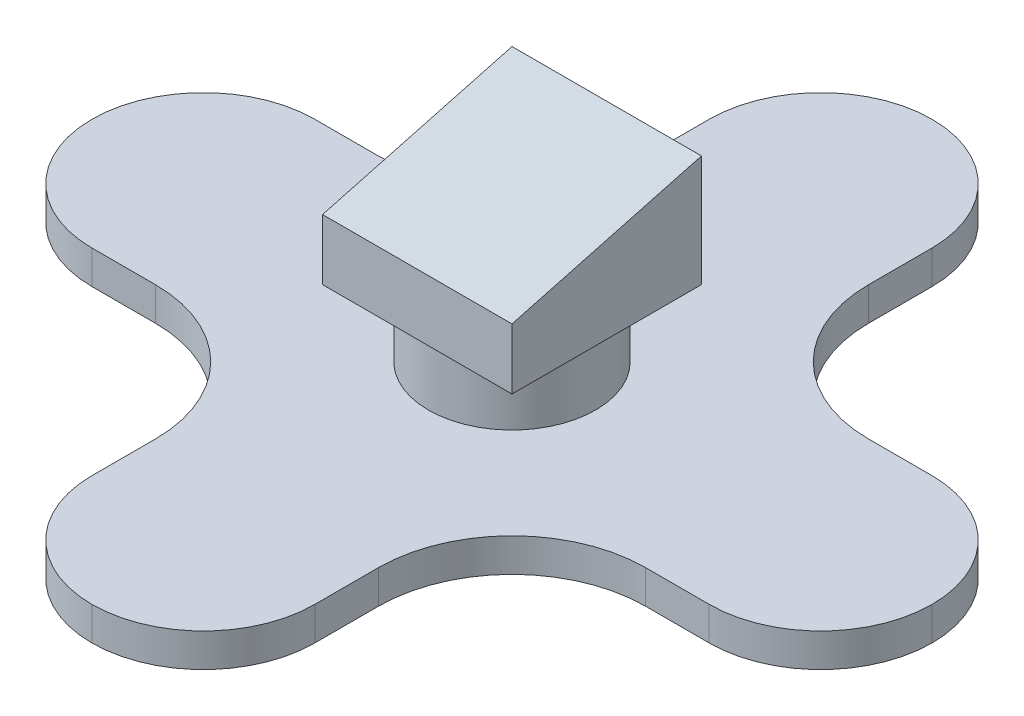
from build123d import *

# Parameters (mm, degrees)
SKETCH1_R           = 3.75
BOSS_EXTRUDE1_DEPTH = 3
SKETCH5_W           = 8.5
SKETCH5_H           = 8.5
BOSS_EXTRUDE3_DEPTH = 5
CUT_EXTRUDE4_DEPTH  = 30
SKETCH2_W           = 10
SKETCH2_H           = 37.69615365
SKETCH2_W_2         = 37.69615365
SKETCH2_H_2         = 10
BOSS_EXTRUDE4_DEPTH = 1.5
FILLET1_R           = 5
FILLET2_R           = 6


with BuildPart() as part:
    # Sketch1 → Boss-Extrude1 (new body)
    with BuildSketch(Plane(origin=(0, 0, 0), x_dir=(1, 0, 0), z_dir=(0, 1, 0))):
        with Locations(Location((0, 0, 0), (0, 0, 270))):
            Circle(SKETCH1_R)
    extrude(amount=BOSS_EXTRUDE1_DEPTH)

    # Sketch5 → Boss-Extrude3 (add)
    with BuildSketch(Plane(origin=(0, 3, 0), x_dir=(1, 0, 0), z_dir=(0, 1, 0))):
        Rectangle(SKETCH5_W, SKETCH5_H)
    extrude(amount=BOSS_EXTRUDE3_DEPTH)

    # Sketch19 → Cut-Extrude4 (cut)
    with BuildSketch(Plane.ZY.offset(4.25)):
        Polygon((-4.25, 8), (4.25, 8), (4.25, 5.722431864), align=None)
    extrude(amount=-CUT_EXTRUDE4_DEPTH, mode=Mode.SUBTRACT)

    # Sketch2 → Boss-Extrude4 (add)
    with BuildSketch(Plane.XZ):
        Rectangle(SKETCH2_W, SKETCH2_H)
        Rectangle(SKETCH2_W_2, SKETCH2_H_2)
    extrude(amount=BOSS_EXTRUDE4_DEPTH)

    # Fillet1
    fillet1_edges = [part.edges().sort_by_distance(p)[0] for p in [
        (18.848076825, -0.75, -5),
        (5, -0.75, -18.848076825),
        (-5, -0.75, -18.848076825),
        (-18.848076825, -0.75, -5),
        (-18.848076825, -0.75, 5),
        (18.848076825, -0.75, 5),
        (5, -0.75, 18.848076825),
        (-5, -0.75, 18.848076825),
    ]]
    fillet(fillet1_edges, radius=FILLET1_R - 0.0001)  # a hair under: the kernel refuses the full size

    # Fillet2
    fillet2_edges = [part.edges().sort_by_distance(p)[0] for p in [
        (5, -0.75, -5),
        (-5, -0.75, 5),
        (-5, -0.75, -5),
        (5, -0.75, 5),
    ]]
    fillet(fillet2_edges, radius=FILLET2_R)


solid = part.part
